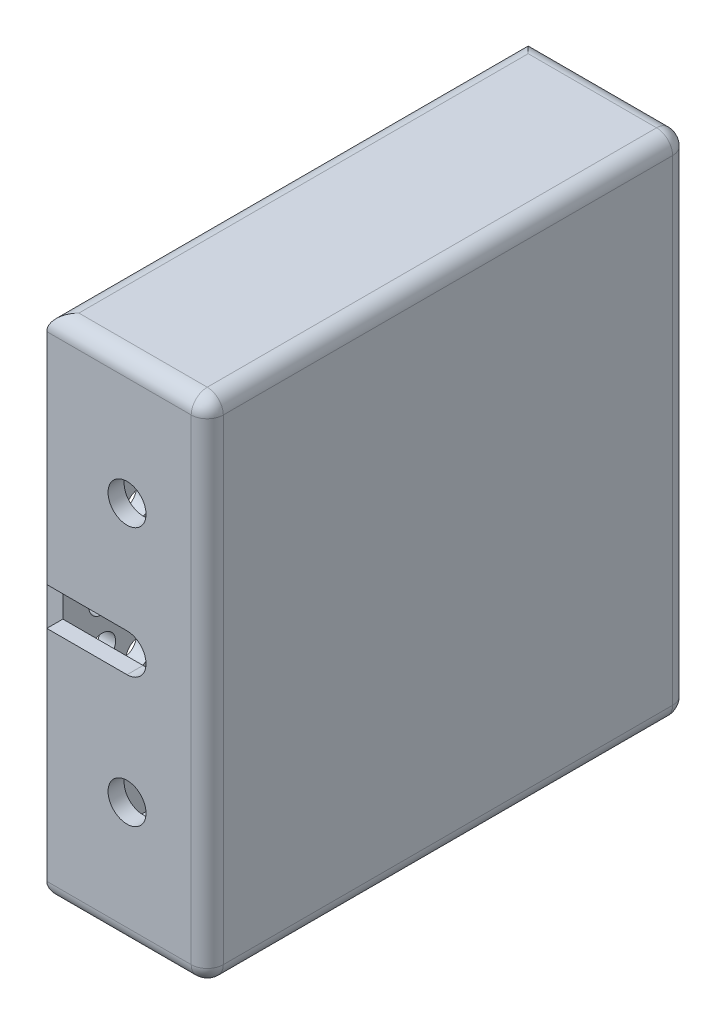
from build123d import *

# Parameters (mm, degrees)
SKETCH1_W                                   = 95
SKETCH1_H                                   = 30
F_30_X_95_X_90_DEPTH                        = 90
F_2_MM_TOP_BOT_3_MM_SIDE_T                  = -3
F_2_MM_TOP_BOT_3_MM_SIDE_THICKNESS_2_FACE_W = 84
F_2_MM_TOP_BOT_3_MM_SIDE_THICKNESS_2_FACE_H = 27
F_2_MM_TOP_BOT_3_MM_SIDE_THICKNESS_2_DEPTH  = 2
F_2_MM_TOP_BOT_3_MM_SIDE_THICKNESS_3_FACE_W = 84
F_2_MM_TOP_BOT_3_MM_SIDE_THICKNESS_3_FACE_H = 27
F_2_MM_TOP_BOT_3_MM_SIDE_THICKNESS_3_DEPTH  = 2
F_10_MM_PORT_HOLES_DEPTH                    = 3
SKETCH4_R                                   = 3.55
F_7_1_MM_FIXTURE_HOLES_DEPTH                = 10
FILLET1_R                                   = 3
BOSS_EXTRUDE1_DEPTH                         = 3
SKETCH7_R                                   = 2.5
CUT_EXTRUDE2_DEPTH                          = 3
FILL_START                                  = -18
FILL_PATTERN3_OUTLINE_R                     = 2.5
FILL_PATTERN3_DEPTH                         = 3


# Read off the part's stored shape, not the designer's step: Fill Pattern3
with BuildPart() as part:
    # Sketch1 → 30 x 95 x 90 (new body)
    with BuildSketch(Plane(origin=(0, 0, 0), x_dir=(0, 1, 0), z_dir=(0, 0, 1))):
        Rectangle(SKETCH1_W, SKETCH1_H)
    extrude(amount=F_30_X_95_X_90_DEPTH)

    # 2 mm top/bot 3 mm side
    f_2_mm_top_bot_3_mm_side_openings = [part.faces().sort_by_distance(p)[0] for p in [
        (-15, 0, 45),
    ]]
    offset(amount=F_2_MM_TOP_BOT_3_MM_SIDE_T, openings=f_2_mm_top_bot_3_mm_side_openings, kind=Kind.INTERSECTION)

    # 2 mm top/bot 3 mm side thickness 2 face (on inner face of the shell) → 2 mm top/bot 3 mm side thickness 2 (add)
    with BuildSketch(Plane(origin=(-1.5, 44.5, 45), x_dir=(0, 0, 1), z_dir=(0, 1, 0))):
        Rectangle(F_2_MM_TOP_BOT_3_MM_SIDE_THICKNESS_2_FACE_W, F_2_MM_TOP_BOT_3_MM_SIDE_THICKNESS_2_FACE_H)
    extrude(amount=-F_2_MM_TOP_BOT_3_MM_SIDE_THICKNESS_2_DEPTH)

    # 2 mm top/bot 3 mm side thickness 3 face (on inner face of the shell) → 2 mm top/bot 3 mm side thickness 3 (add)
    with BuildSketch(Plane(origin=(-1.5, -44.5, 45), x_dir=(0, 0, -1), z_dir=(0, -1, 0))):
        Rectangle(F_2_MM_TOP_BOT_3_MM_SIDE_THICKNESS_3_FACE_W, F_2_MM_TOP_BOT_3_MM_SIDE_THICKNESS_3_FACE_H)
    extrude(amount=-F_2_MM_TOP_BOT_3_MM_SIDE_THICKNESS_3_DEPTH)

    # Sketch3 → 10 mm port holes (cut)
    with BuildSketch(Plane(origin=(0, 0, 0), x_dir=(1, 0, 0), z_dir=(0, 0, -1))):
        with BuildLine():
            ThreePointArc((5, 30), (3.535533906, 33.535533906), (0, 35))
            Line((0, 35), (0, 25))
            ThreePointArc((0, 25), (3.535533906, 26.464466094), (5, 30))
        make_face()
        with BuildLine():
            Line((0, 25), (0, 35))
            ThreePointArc((0, 35), (-5, 30), (0, 25))
        make_face()
        with BuildLine():
            ThreePointArc((5, 10), (3.535533906, 13.535533906), (0, 15))
            Line((0, 15), (0, 5))
            ThreePointArc((0, 5), (3.535533906, 6.464466094), (5, 10))
        make_face()
        with BuildLine():
            Line((0, 5), (0, 15))
            ThreePointArc((0, 15), (-5, 10), (0, 5))
        make_face()
        with BuildLine():
            ThreePointArc((5, -10), (3.535533906, -6.464466094), (0, -5))
            Line((0, -5), (0, -15))
            ThreePointArc((0, -15), (3.535533906, -13.535533906), (5, -10))
        make_face()
        with BuildLine():
            Line((0, -15), (0, -5))
            ThreePointArc((0, -5), (-5, -10), (0, -15))
        make_face()
        with BuildLine():
            ThreePointArc((5, -30), (3.535533906, -26.464466094), (0, -25))
            Line((0, -25), (0, -27.5))
            Line((0, -27.5), (0, -35))
            ThreePointArc((0, -35), (3.535533906, -33.535533906), (5, -30))
        make_face()
        with BuildLine():
            Line((0, -27.5), (0, -25))
            ThreePointArc((0, -25), (-5, -30), (0, -35))
            Line((0, -35), (0, -27.5))
        make_face()
    extrude(amount=-F_10_MM_PORT_HOLES_DEPTH, mode=Mode.SUBTRACT)

    # Sketch4 → 7.1 mm fixture holes (cut)
    with BuildSketch(Plane.XY.offset(90)):
        with Locations((0, 24.2)):
            Circle(SKETCH4_R)
        Circle(SKETCH4_R)
        with Locations((0, -24.2)):
            Circle(SKETCH4_R)
        with BuildLine():
            ThreePointArc((0, -3.55), (-3.55, 0), (0, 3.55))
            Line((0, 3.55), (-15, 3.55))
            Line((-15, 3.55), (-15, -3.55))
            Line((-15, -3.55), (0, -3.55))
        make_face()
    extrude(amount=-F_7_1_MM_FIXTURE_HOLES_DEPTH, mode=Mode.SUBTRACT)

    # Fillet1
    fillet1_edges = [part.edges().sort_by_distance(p)[0] for p in [
        (0, 47.5, 90),
        (12, 0, 3),
        (12, -42.5, 45),
        (12, 42.5, 45),
        (12, 0, 87),
        (0, -47.5, 90),
        (15, 0, 90),
        (0, -47.5, 0),
        (0, 47.5, 0),
        (15, 0, 0),
        (15, -47.5, 45),
        (-15, -47.5, 45),
        (-15, 47.5, 45),
        (15, 47.5, 45),
    ]]
    fillet(fillet1_edges, radius=FILLET1_R)


with BuildPart() as body_2:
    # Sketch6 → Boss-Extrude1 (new body)
    with BuildSketch(Plane(origin=(-15, 0, 0), x_dir=(0, -1, 0), z_dir=(-1, 0, 0))):
        with BuildLine():
            Line((-32.5, 3), (32.5, 3))
            ThreePointArc((32.5, 3), (39.571067812, 5.928932188), (42.5, 13))
            Line((42.5, 13), (42.5, 77))
            ThreePointArc((42.5, 77), (39.571067812, 84.071067812), (32.5, 87))
            Line((32.5, 87), (-32.5, 87))
            ThreePointArc((-32.5, 87), (-39.571067812, 84.071067812), (-42.5, 77))
            Line((-42.5, 77), (-42.5, 13))
            ThreePointArc((-42.5, 13), (-39.571067812, 5.928932188), (-32.5, 3))
        make_face()
    extrude(amount=BOSS_EXTRUDE1_DEPTH)

    # Sketch7 → Cut-Extrude2 (cut)
    with BuildSketch(Plane(origin=(-18, 0, 0), x_dir=(0, -1, 0), z_dir=(-1, 0, 0))):
        with Locations((0, 45)):
            Circle(SKETCH7_R)
    extrude(amount=-CUT_EXTRUDE2_DEPTH, mode=Mode.SUBTRACT)

    # Fill Pattern3 outline → Fill Pattern3 (cut)
    with BuildSketch(Plane.YZ.offset(FILL_START)):
        with Locations((36, 79.641016151)):
            Circle(FILL_PATTERN3_OUTLINE_R)
        with Locations((-28, 51.92820323)):
            Circle(FILL_PATTERN3_OUTLINE_R)
        with Locations((-32, 58.856406461)):
            Circle(FILL_PATTERN3_OUTLINE_R)
        with Locations((-36, 65.784609691)):
            Circle(FILL_PATTERN3_OUTLINE_R)
        with Locations((-12, 10.358983849)):
            Circle(FILL_PATTERN3_OUTLINE_R)
        with Locations((-24, 45)):
            Circle(FILL_PATTERN3_OUTLINE_R)
        with Locations((-20, 38.07179677)):
            Circle(FILL_PATTERN3_OUTLINE_R)
        with Locations((-16, 31.143593539)):
            Circle(FILL_PATTERN3_OUTLINE_R)
        with Locations((-12, 24.215390309)):
            Circle(FILL_PATTERN3_OUTLINE_R)
        with Locations((-24, 17.287187079)):
            Circle(FILL_PATTERN3_OUTLINE_R)
        with Locations((-20, 10.358983849)):
            Circle(FILL_PATTERN3_OUTLINE_R)
        with Locations((-36, 51.92820323)):
            Circle(FILL_PATTERN3_OUTLINE_R)
        with Locations((-32, 45)):
            Circle(FILL_PATTERN3_OUTLINE_R)
        with Locations((-28, 38.07179677)):
            Circle(FILL_PATTERN3_OUTLINE_R)
        with Locations((-24, 31.143593539)):
            Circle(FILL_PATTERN3_OUTLINE_R)
        with Locations((-20, 24.215390309)):
            Circle(FILL_PATTERN3_OUTLINE_R)
        with Locations((-16, 17.287187079)):
            Circle(FILL_PATTERN3_OUTLINE_R)
        with Locations((-12, 38.07179677)):
            Circle(FILL_PATTERN3_OUTLINE_R)
        with Locations((-8, 31.143593539)):
            Circle(FILL_PATTERN3_OUTLINE_R)
        with Locations((-4, 24.215390309)):
            Circle(FILL_PATTERN3_OUTLINE_R)
        with Locations((0, 17.287187079)):
            Circle(FILL_PATTERN3_OUTLINE_R)
        with Locations((-20, 65.784609691)):
            Circle(FILL_PATTERN3_OUTLINE_R)
        with Locations((-24, 72.712812921)):
            Circle(FILL_PATTERN3_OUTLINE_R)
        with Locations((-28, 79.641016151)):
            Circle(FILL_PATTERN3_OUTLINE_R)
        with Locations((4, 10.358983849)):
            Circle(FILL_PATTERN3_OUTLINE_R)
        with Locations((-8, 17.287187079)):
            Circle(FILL_PATTERN3_OUTLINE_R)
        with Locations((-4, 10.358983849)):
            Circle(FILL_PATTERN3_OUTLINE_R)
        with Locations((-36, 79.641016151)):
            Circle(FILL_PATTERN3_OUTLINE_R)
        with Locations((-32, 72.712812921)):
            Circle(FILL_PATTERN3_OUTLINE_R)
        with Locations((-28, 65.784609691)):
            Circle(FILL_PATTERN3_OUTLINE_R)
        with Locations((-24, 58.856406461)):
            Circle(FILL_PATTERN3_OUTLINE_R)
        with Locations((-20, 51.92820323)):
            Circle(FILL_PATTERN3_OUTLINE_R)
        with Locations((-16, 45)):
            Circle(FILL_PATTERN3_OUTLINE_R)
        with Locations((-36, 10.358983849)):
            Circle(FILL_PATTERN3_OUTLINE_R)
        with Locations((-36, 24.215390309)):
            Circle(FILL_PATTERN3_OUTLINE_R)
        with Locations((-32, 17.287187079)):
            Circle(FILL_PATTERN3_OUTLINE_R)
        with Locations((-28, 24.215390309)):
            Circle(FILL_PATTERN3_OUTLINE_R)
        with Locations((-32, 31.143593539)):
            Circle(FILL_PATTERN3_OUTLINE_R)
        with Locations((-36, 38.07179677)):
            Circle(FILL_PATTERN3_OUTLINE_R)
        with Locations((-28, 10.358983849)):
            Circle(FILL_PATTERN3_OUTLINE_R)
        with Locations((32, 31.143593539)):
            Circle(FILL_PATTERN3_OUTLINE_R)
        with Locations((28, 38.07179677)):
            Circle(FILL_PATTERN3_OUTLINE_R)
        with Locations((24, 45)):
            Circle(FILL_PATTERN3_OUTLINE_R)
        with Locations((20, 51.92820323)):
            Circle(FILL_PATTERN3_OUTLINE_R)
        with Locations((16, 58.856406461)):
            Circle(FILL_PATTERN3_OUTLINE_R)
        with Locations((12, 65.784609691)):
            Circle(FILL_PATTERN3_OUTLINE_R)
        with Locations((8, 72.712812921)):
            Circle(FILL_PATTERN3_OUTLINE_R)
        with Locations((4, 79.641016151)):
            Circle(FILL_PATTERN3_OUTLINE_R)
        with Locations((36, 10.358983849)):
            Circle(FILL_PATTERN3_OUTLINE_R)
        with Locations((32, 17.287187079)):
            Circle(FILL_PATTERN3_OUTLINE_R)
        with Locations((28, 24.215390309)):
            Circle(FILL_PATTERN3_OUTLINE_R)
        with Locations((24, 31.143593539)):
            Circle(FILL_PATTERN3_OUTLINE_R)
        with Locations((20, 38.07179677)):
            Circle(FILL_PATTERN3_OUTLINE_R)
        with Locations((16, 45)):
            Circle(FILL_PATTERN3_OUTLINE_R)
        with Locations((12, 51.92820323)):
            Circle(FILL_PATTERN3_OUTLINE_R)
        with Locations((8, 58.856406461)):
            Circle(FILL_PATTERN3_OUTLINE_R)
        with Locations((20, 79.641016151)):
            Circle(FILL_PATTERN3_OUTLINE_R)
        with Locations((24, 72.712812921)):
            Circle(FILL_PATTERN3_OUTLINE_R)
        with Locations((28, 65.784609691)):
            Circle(FILL_PATTERN3_OUTLINE_R)
        with Locations((32, 58.856406461)):
            Circle(FILL_PATTERN3_OUTLINE_R)
        with Locations((36, 65.784609691)):
            Circle(FILL_PATTERN3_OUTLINE_R)
        with Locations((32, 72.712812921)):
            Circle(FILL_PATTERN3_OUTLINE_R)
        with Locations((28, 79.641016151)):
            Circle(FILL_PATTERN3_OUTLINE_R)
        with Locations((36, 51.92820323)):
            Circle(FILL_PATTERN3_OUTLINE_R)
        with Locations((20, 65.784609691)):
            Circle(FILL_PATTERN3_OUTLINE_R)
        with Locations((16, 72.712812921)):
            Circle(FILL_PATTERN3_OUTLINE_R)
        with Locations((12, 79.641016151)):
            Circle(FILL_PATTERN3_OUTLINE_R)
        with Locations((36, 24.215390309)):
            Circle(FILL_PATTERN3_OUTLINE_R)
        with Locations((24, 58.856406461)):
            Circle(FILL_PATTERN3_OUTLINE_R)
        with Locations((28, 51.92820323)):
            Circle(FILL_PATTERN3_OUTLINE_R)
        with Locations((32, 45)):
            Circle(FILL_PATTERN3_OUTLINE_R)
        with Locations((36, 38.07179677)):
            Circle(FILL_PATTERN3_OUTLINE_R)
        with Locations((12, 24.215390309)):
            Circle(FILL_PATTERN3_OUTLINE_R)
        with Locations((8, 31.143593539)):
            Circle(FILL_PATTERN3_OUTLINE_R)
        with Locations((4, 38.07179677)):
            Circle(FILL_PATTERN3_OUTLINE_R)
        with Locations((-4, 51.92820323)):
            Circle(FILL_PATTERN3_OUTLINE_R)
        with Locations((-8, 58.856406461)):
            Circle(FILL_PATTERN3_OUTLINE_R)
        with Locations((-12, 65.784609691)):
            Circle(FILL_PATTERN3_OUTLINE_R)
        with Locations((-16, 72.712812921)):
            Circle(FILL_PATTERN3_OUTLINE_R)
        with Locations((-20, 79.641016151)):
            Circle(FILL_PATTERN3_OUTLINE_R)
        with Locations((12, 10.358983849)):
            Circle(FILL_PATTERN3_OUTLINE_R)
        with Locations((8, 17.287187079)):
            Circle(FILL_PATTERN3_OUTLINE_R)
        with Locations((4, 24.215390309)):
            Circle(FILL_PATTERN3_OUTLINE_R)
        with Locations((0, 31.143593539)):
            Circle(FILL_PATTERN3_OUTLINE_R)
        with Locations((-4, 38.07179677)):
            Circle(FILL_PATTERN3_OUTLINE_R)
        with Locations((-8, 45)):
            Circle(FILL_PATTERN3_OUTLINE_R)
        with Locations((-12, 51.92820323)):
            Circle(FILL_PATTERN3_OUTLINE_R)
        with Locations((-16, 58.856406461)):
            Circle(FILL_PATTERN3_OUTLINE_R)
        with Locations((12, 38.07179677)):
            Circle(FILL_PATTERN3_OUTLINE_R)
        with Locations((16, 31.143593539)):
            Circle(FILL_PATTERN3_OUTLINE_R)
        with Locations((20, 24.215390309)):
            Circle(FILL_PATTERN3_OUTLINE_R)
        with Locations((24, 17.287187079)):
            Circle(FILL_PATTERN3_OUTLINE_R)
        with Locations((4, 65.784609691)):
            Circle(FILL_PATTERN3_OUTLINE_R)
        with Locations((0, 72.712812921)):
            Circle(FILL_PATTERN3_OUTLINE_R)
        with Locations((-4, 79.641016151)):
            Circle(FILL_PATTERN3_OUTLINE_R)
        with Locations((28, 10.358983849)):
            Circle(FILL_PATTERN3_OUTLINE_R)
        with Locations((16, 17.287187079)):
            Circle(FILL_PATTERN3_OUTLINE_R)
        with Locations((20, 10.358983849)):
            Circle(FILL_PATTERN3_OUTLINE_R)
        with Locations((-12, 79.641016151)):
            Circle(FILL_PATTERN3_OUTLINE_R)
        with Locations((-8, 72.712812921)):
            Circle(FILL_PATTERN3_OUTLINE_R)
        with Locations((-4, 65.784609691)):
            Circle(FILL_PATTERN3_OUTLINE_R)
        with Locations((0, 58.856406461)):
            Circle(FILL_PATTERN3_OUTLINE_R)
        with Locations((4, 51.92820323)):
            Circle(FILL_PATTERN3_OUTLINE_R)
        with Locations((8, 45)):
            Circle(FILL_PATTERN3_OUTLINE_R)
    extrude(amount=FILL_PATTERN3_DEPTH, mode=Mode.SUBTRACT)


solid = Compound([part.part, body_2.part])
